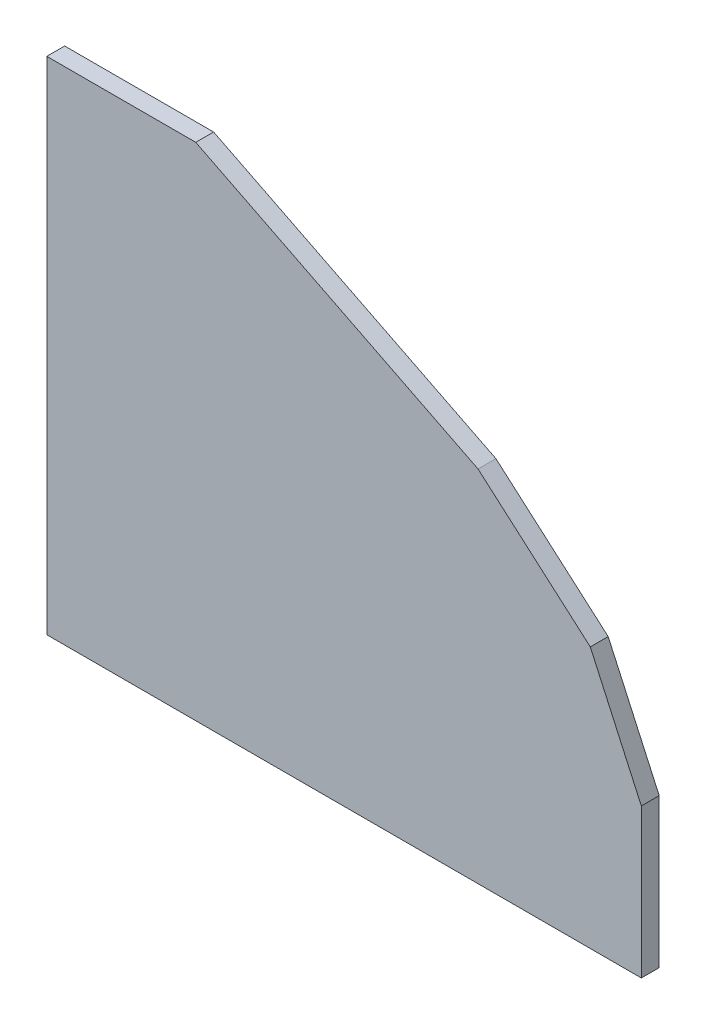
from build123d import *

# Parameters (mm, degrees)
SM_BASE_FLANGE_1_DEPTH = 6


# Sheet-metal steps are written as plain solids
with BuildPart() as part:
    # Sketch 1 → Базовая кромка1 (new body)
    with BuildSketch(Plane.XY):
        Polygon((249.538430592, 50), (50, 50), (50, 218.11979273), (100, 218.11979273), (194.738205571, 170.547557291), (232.412096727, 137.673891156), (249.538430592, 100), align=None)
    extrude(amount=-SM_BASE_FLANGE_1_DEPTH)


solid = part.part
